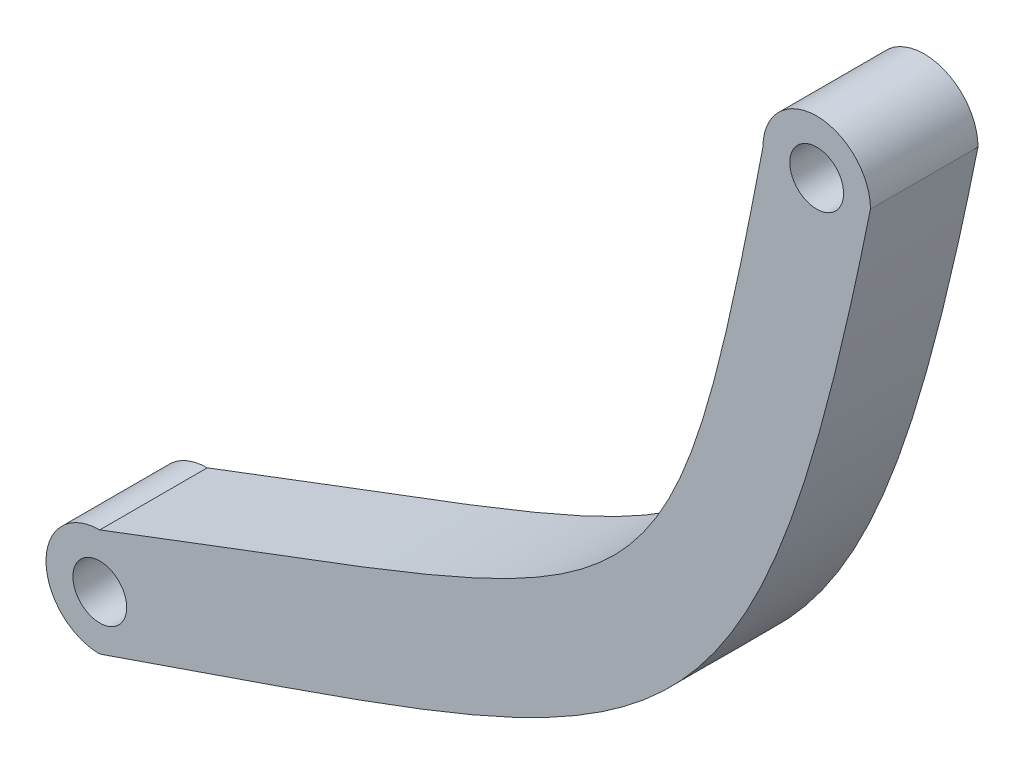
from build123d import *

# Parameters (mm, degrees)
BOSS_EXTRU_1_DEPTH      = 3
BOSS_EXTRU_1_DEPTH_BACK = 3
ESQUISSE1_R             = 1.5


with BuildPart() as part:
    # Esquisse1 → Boss.-Extru.1 (new, two sides: drawn at the far end of the back side and taken through both)
    with BuildSketch(Plane.XY.offset(-BOSS_EXTRU_1_DEPTH_BACK)):
        with BuildLine():
            ThreePointArc((0, 3), (-3, 0), (0, -3))
            add(Edge.make_bspline(
                [(0, -3), (31.478158368, 7.96524769), (36.359532073, 7.334799912), (43, 40)],
                knots=[0, 0, 0, 0, 1, 1, 1, 1], degree=3))
            ThreePointArc((43, 40), (40, 43), (37, 40))
            add(Edge.make_bspline(
                [(0, 3), (31.115728441, 14.955022154), (31.664729171, 12.359061598), (37, 40)],
                knots=[0, 0, 0, 0, 1, 1, 1, 1], degree=3))
        make_face()
        Circle(ESQUISSE1_R, mode=Mode.SUBTRACT)
        with Locations((40, 40)):
            Circle(ESQUISSE1_R, mode=Mode.SUBTRACT)
    extrude(amount=BOSS_EXTRU_1_DEPTH + BOSS_EXTRU_1_DEPTH_BACK)


solid = part.part
